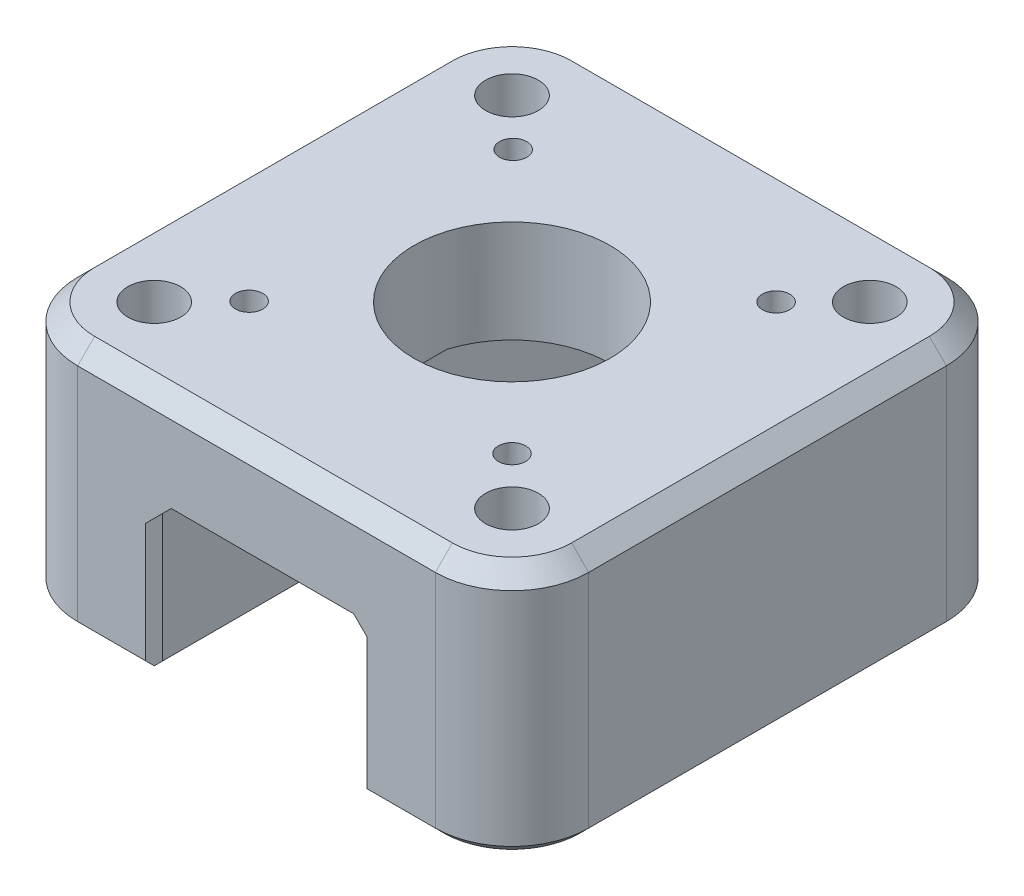
from build123d import *

# Parameters (mm, degrees)
SKETCH_1_W           = 60
SKETCH_1_H           = 60
EXTRUDE_1_DEPTH      = 7
SKETCH_2_W           = 18
SKETCH_2_H           = 60
SKETCH_2_R           = 3
EXTRUDE_2_DEPTH      = 15
SKETCH_3_W           = 43
SKETCH_3_H           = 70
CUT_EXTRUDE_1_DEPTH  = 7
SKETCH_4_W           = 24
SKETCH_4_H           = 60
EXTRUDE_3_DEPTH      = 15
SKETCH_12_W          = 24
SKETCH_12_H          = 12
CUT_EXTRUDE_8_DEPTH  = 87
FILLET_START         = -16
FILLET_8_DEPTH       = 24
CHAMFER_23_SIZE      = 1
CHAMFER_24_SIZE      = 1
EXTRUDE_4_DEPTH      = 7
EXTRUDE_5_DEPTH      = 7
SKETCH_23_W          = 24
SKETCH_23_H          = 60
CUT_EXTRUDE_9_DEPTH  = 11
SKETCH_24_R          = 11.5
SKETCH_24_R_2        = 1.6
CUT_EXTRUDE_10_DEPTH = 34
SKETCH_25_R          = 3
CUT_EXTRUDE_11_DEPTH = 3
CHAMFER_25_SIZE      = 2
CHAMFER_26_SIZE      = 1
CHAMFER_27_SIZE      = 1
CHAMFER_28_SIZE      = 1
SKETCH_26_W          = 14
SKETCH_26_H          = 14
CUT_EXTRUDE_12_DEPTH = 12
SKETCH_28_R          = 3.1
CUT_EXTRUDE_13_DEPTH = 15
SKETCH_30_R          = 3
CUT_EXTRUDE_14_DEPTH = 10
SKETCH_31_R          = 3.1
CUT_EXTRUDE_15_DEPTH = 35


with BuildPart() as part:
    # 草图1 → 凸台-拉伸1 (new body)
    with BuildSketch(Plane(origin=(0, 0, 0), x_dir=(1, 0, 0), z_dir=(0, 1, 0))):
        Rectangle(SKETCH_1_W, SKETCH_1_H)
    extrude(amount=EXTRUDE_1_DEPTH)

    # 草图2 → 凸台-拉伸2 (add)
    # profile 1 of 2: a face of its own
    with BuildSketch(Plane.XZ):
        with Locations((-21, 0)):
            Rectangle(SKETCH_2_W, SKETCH_2_H)
        with Locations(Location((-21, 21, 0), (0, 0, 270))):
            Circle(SKETCH_2_R, mode=Mode.SUBTRACT)
        with Locations(Location((-21, -21, 0), (0, 0, 270))):
            Circle(SKETCH_2_R, mode=Mode.SUBTRACT)
    # profile 2 of 2: a face of its own
    with BuildSketch(Plane.XZ):
        with Locations((21, 0)):
            Rectangle(SKETCH_2_W, SKETCH_2_H)
        with Locations(Location((21, -21, 0), (0, 0, 90))):
            Circle(SKETCH_2_R, mode=Mode.SUBTRACT)
        with Locations(Location((21, 21, 0), (0, 0, 90))):
            Circle(SKETCH_2_R, mode=Mode.SUBTRACT)
    extrude(amount=EXTRUDE_2_DEPTH)

    # 草图3 → 切除-拉伸1 (cut)
    with BuildSketch(Plane(origin=(0, 7, 0), x_dir=(1, 0, 0), z_dir=(0, 1, 0))):
        with Locations((0, 30)):
            Rectangle(SKETCH_3_W, SKETCH_3_H)
    extrude(amount=-CUT_EXTRUDE_1_DEPTH, mode=Mode.SUBTRACT)

    # 草图4 → 凸台-拉伸3 (add)
    with BuildSketch(Plane.XZ):
        Rectangle(SKETCH_4_W, SKETCH_4_H)
    extrude(amount=EXTRUDE_3_DEPTH)

    # 草图12 → 切除-拉伸8 (cut)
    with BuildSketch(Plane(origin=(0, 0, -30), x_dir=(-1, 0, 0), z_dir=(0, 0, -1))):
        with Locations((0, -15)):
            Rectangle(SKETCH_12_W, SKETCH_12_H)
    extrude(amount=-CUT_EXTRUDE_8_DEPTH, mode=Mode.SUBTRACT)

    # 圆角8: read off the stored shape, not the designer's step
    # 圆角8 outline → 圆角8 (cut)
    with BuildSketch(Plane(origin=(0, 0, 0), x_dir=(1, 0, 0), z_dir=(0, 1, 0)).offset(FILLET_START)):
        with BuildLine():
            Line((-30, 30), (-30, 21))
            ThreePointArc((-30, 21), (-27.363961031, 27.363961031), (-21, 30))
            Line((-21, 30), (-30, 30))
        make_face()
        with BuildLine():
            ThreePointArc((-21, -30), (-27.363961031, -27.363961031), (-30, -21))
            Line((-30, -21), (-30, -30))
            Line((-30, -30), (-21, -30))
        make_face()
        with BuildLine():
            Line((30, 30), (21, 30))
            ThreePointArc((21, 30), (27.363961031, 27.363961031), (30, 21))
            Line((30, 21), (30, 30))
        make_face()
        with BuildLine():
            ThreePointArc((30, -21), (27.363961031, -27.363961031), (21, -30))
            Line((21, -30), (30, -30))
            Line((30, -30), (30, -21))
        make_face()
    extrude(amount=FILLET_8_DEPTH, mode=Mode.SUBTRACT)

    # 倒角23
    chamfer_23_edges = [part.edges().sort_by_distance(p)[0] for p in [
        (-21, -15, 24),
        (-21, -15, -18),
        (21, -15, -24),
        (21, -15, 18),
    ]]
    chamfer(chamfer_23_edges, length=CHAMFER_23_SIZE)

    # 倒角24
    chamfer_24_edges = [part.edges().sort_by_distance(p)[0] for p in [
        (-30, -15, 0),
        (-16.5, -15, -30),
        (-27.363961031, -15, 27.363961031),
        (-27.363961031, -15, -27.363961031),
        (30, -15, 0),
        (16.5, -15, 30),
        (27.363961031, -15, 27.363961031),
        (27.363961031, -15, -27.363961031),
        (16.5, -15, -30),
        (-16.5, -15, 30),
    ]]
    chamfer(chamfer_24_edges, length=CHAMFER_24_SIZE)

    # 草图21 → 凸台-拉伸4 (add)
    with BuildSketch(Plane(origin=(0, 0, 0), x_dir=(1, 0, 0), z_dir=(0, 1, 0))):
        with BuildLine():
            Line((-21.5, 23.958039892), (-21.5, 18.041960108))
            Line((-21.5, 18.041960108), (-21.5, -5))
            Line((-21.5, -5), (21.5, -5))
            Line((21.5, -5), (21.5, 18.041960108))
            Line((21.5, 18.041960108), (21.5, 23.958039892))
            Line((21.5, 23.958039892), (21.5, 29.986100378))
            ThreePointArc((21.5, 29.986100378), (21.250096581, 29.996524423), (21, 30))
            Line((21, 30), (-21, 30))
            ThreePointArc((-21, 30), (-21.250096581, 29.996524423), (-21.5, 29.986100378))
            Line((-21.5, 29.986100378), (-21.5, 23.958039892))
        make_face()
    extrude(amount=EXTRUDE_4_DEPTH)

    # 草图22 → 凸台-拉伸5 (add)
    with BuildSketch(Plane(origin=(0, 7, 0), x_dir=(1, 0, 0), z_dir=(0, 1, 0))):
        with BuildLine():
            Line((21, 30), (-21, 30))
            ThreePointArc((-21, 30), (-27.363961031, 27.363961031), (-30, 21))
            Line((-30, 21), (-30, -21))
            ThreePointArc((-30, -21), (-27.363961031, -27.363961031), (-21, -30))
            Line((-21, -30), (21, -30))
            ThreePointArc((21, -30), (27.363961031, -27.363961031), (30, -21))
            Line((30, -21), (30, 21))
            ThreePointArc((30, 21), (27.363961031, 27.363961031), (21, 30))
        make_face()
    extrude(amount=EXTRUDE_5_DEPTH)

    # 草图23 → 切除-拉伸9 (cut)
    with BuildSketch(Plane.XZ.offset(9)):
        Rectangle(SKETCH_23_W, SKETCH_23_H)
    extrude(amount=-CUT_EXTRUDE_9_DEPTH, mode=Mode.SUBTRACT)

    # 草图24 → 切除-拉伸10 (cut)
    with BuildSketch(Plane(origin=(0, 14, 0), x_dir=(1, 0, 0), z_dir=(0, 1, 0))):
        with Locations(Location((0, 0, 0), (0, 0, 270))):
            Circle(SKETCH_24_R)
        with Locations(Location((15.5, 15.5, 0), (0, 0, 270))):
            Circle(SKETCH_24_R_2)
        with Locations(Location((15.429289322, -15.429289322, 0), (0, 0, 270))):
            Circle(SKETCH_24_R_2)
        with Locations(Location((-15.5, -15.358578644, 0), (0, 0, 270))):
            Circle(SKETCH_24_R_2)
        with Locations(Location((-15.429289322, 15.570710678, 0), (0, 0, 270))):
            Circle(SKETCH_24_R_2)
    extrude(amount=-CUT_EXTRUDE_10_DEPTH, mode=Mode.SUBTRACT)

    # 草图25 → 切除-拉伸11 (cut)
    with BuildSketch(Plane.XZ.offset(15)):
        with Locations(Location((15.5, -15.5, 0), (0, 0, 270))):
            Circle(SKETCH_25_R)
        with Locations(Location((-15.5, -15.5, 0), (0, 0, 270))):
            Circle(SKETCH_25_R)
        with Locations(Location((-15.5, 15.5, 0), (0, 0, 270))):
            Circle(SKETCH_25_R)
        with Locations(Location((15.5, 15.5, 0), (0, 0, 270))):
            Circle(SKETCH_25_R)
    extrude(amount=-CUT_EXTRUDE_11_DEPTH, mode=Mode.SUBTRACT)

    # 倒角25
    chamfer_25_edges = [part.edges().sort_by_distance(p)[0] for p in [
        (27.363961031, 14, -27.363961031),
        (0, 14, -30),
        (-27.363961031, 14, -27.363961031),
        (-30, 14, 0),
        (-27.363961031, 14, 27.363961031),
        (0, 14, 30),
        (27.363961031, 14, 27.363961031),
        (30, 14, 0),
    ]]
    chamfer(chamfer_25_edges, length=CHAMFER_25_SIZE)

    # 倒角26
    # the kernel refuses this chamfer: 1 mm, written as the material it adds along each edge
    with BuildSketch(Plane(origin=(12, 2, -30), x_dir=(0, -1, 0), z_dir=(0, 0, 1))) as chamfer_26_piece_1_section:
        Polygon((CHAMFER_26_SIZE, 0), (0, -CHAMFER_26_SIZE), (0, 0), align=None)
    chamfer_26_piece_1 = extrude(amount=60, mode=Mode.PRIVATE)
    chamfer_26_piece_1 = chamfer_26_piece_1 - Plane(origin=(0, 2, 0), x_dir=(0, 0, 1), z_dir=(0, 1, 0)) * Cylinder(11.5, 124, mode=Mode.PRIVATE)
    add(chamfer_26_piece_1)
    with BuildSketch(Plane(origin=(-12, 2, 30), x_dir=(1, 0, 0), z_dir=(0, 0, -1))) as chamfer_26_piece_2_section:
        Polygon((CHAMFER_26_SIZE, 0), (0, CHAMFER_26_SIZE), (0, 0), align=None)
    chamfer_26_piece_2 = extrude(amount=60, mode=Mode.PRIVATE)
    chamfer_26_piece_2 = chamfer_26_piece_2 - Plane(origin=(0, 2, 0), x_dir=(0, 0, 1), z_dir=(0, 1, 0)) * Cylinder(11.5, 124, mode=Mode.PRIVATE)
    add(chamfer_26_piece_2)
    # the kernel refuses this chamfer: 1 mm, written as the material it takes off along each edge
    with BuildSketch(Plane(origin=(-12, -15, 31.571682988), x_dir=(-1, 0, 0), z_dir=(0, 0, -1)), Plane(origin=(12, -15, -31.571682988), x_dir=(1, 0, 0), z_dir=(0, 0, 1))) as chamfer_26_2_piece_1:
        Polygon((CHAMFER_26_SIZE, 0), (0, CHAMFER_26_SIZE), (0, 0), align=None)
    extrude(amount=63.143365976, mode=Mode.SUBTRACT)

    # 倒角27
    chamfer_27_edges = [part.edges().sort_by_distance(p)[0] for p in [
        (-12, -6.5, -30),
        (0, 2, -30),
        (12, -6.5, -30),
        (11.5, 1.5, -30),
        (-11.5, 1.5, -30),
    ]]
    chamfer(chamfer_27_edges, length=CHAMFER_27_SIZE)

    # 倒角28
    chamfer_28_edges = [part.edges().sort_by_distance(p)[0] for p in [
        (-12, -6.5, 30),
        (0, 2, 30),
        (12, -6.5, 30),
        (11.5, 1.5, 30),
    ]]
    chamfer(chamfer_28_edges, length=CHAMFER_28_SIZE)

    # 草图26 → 切除-拉伸12 (cut)
    with BuildSketch(Plane.XZ.offset(15)):
        with Locations((12, 0)):
            Rectangle(SKETCH_26_W, SKETCH_26_H)
    extrude(amount=-CUT_EXTRUDE_12_DEPTH, mode=Mode.SUBTRACT)

    # 草图28 → 切除-拉伸13 (cut)
    with BuildSketch(Plane.XZ.offset(15)):
        with Locations(Location((-21, 21, 0), (0, 0, 270))):
            Circle(SKETCH_28_R)
        with Locations(Location((21, 21, 0), (0, 0, 270))):
            Circle(SKETCH_28_R)
        with Locations(Location((21, -21, 0), (0, 0, 270))):
            Circle(SKETCH_28_R)
        with Locations(Location((-21, -21, 0), (0, 0, 270))):
            Circle(SKETCH_28_R)
    extrude(amount=-CUT_EXTRUDE_13_DEPTH, mode=Mode.SUBTRACT)

    # 草图30 → 切除-拉伸14 (cut)
    with BuildSketch(Plane.XZ.offset(12)):
        with Locations(Location((-15.5, 15.5, 0), (0, 0, 270))):
            Circle(SKETCH_30_R)
        with Locations(Location((15.5, 15.5, 0), (0, 0, 270))):
            Circle(SKETCH_30_R)
        with Locations(Location((15.5, -15.5, 0), (0, 0, 270))):
            Circle(SKETCH_30_R)
        with Locations(Location((-15.5, -15.5, 0), (0, 0, 270))):
            Circle(SKETCH_30_R)
    extrude(amount=-CUT_EXTRUDE_14_DEPTH, mode=Mode.SUBTRACT)

    # 草图31 → 切除-拉伸15 (cut)
    with BuildSketch(Plane.XZ):
        with Locations(Location((-21, 21, 0), (0, 0, 270))):
            Circle(SKETCH_31_R)
        with Locations(Location((21, 21, 0), (0, 0, 270))):
            Circle(SKETCH_31_R)
        with Locations(Location((21, -21, 0), (0, 0, 270))):
            Circle(SKETCH_31_R)
        with Locations(Location((-21, -21, 0), (0, 0, 270))):
            Circle(SKETCH_31_R)
    extrude(amount=-CUT_EXTRUDE_15_DEPTH, mode=Mode.SUBTRACT)


solid = part.part
